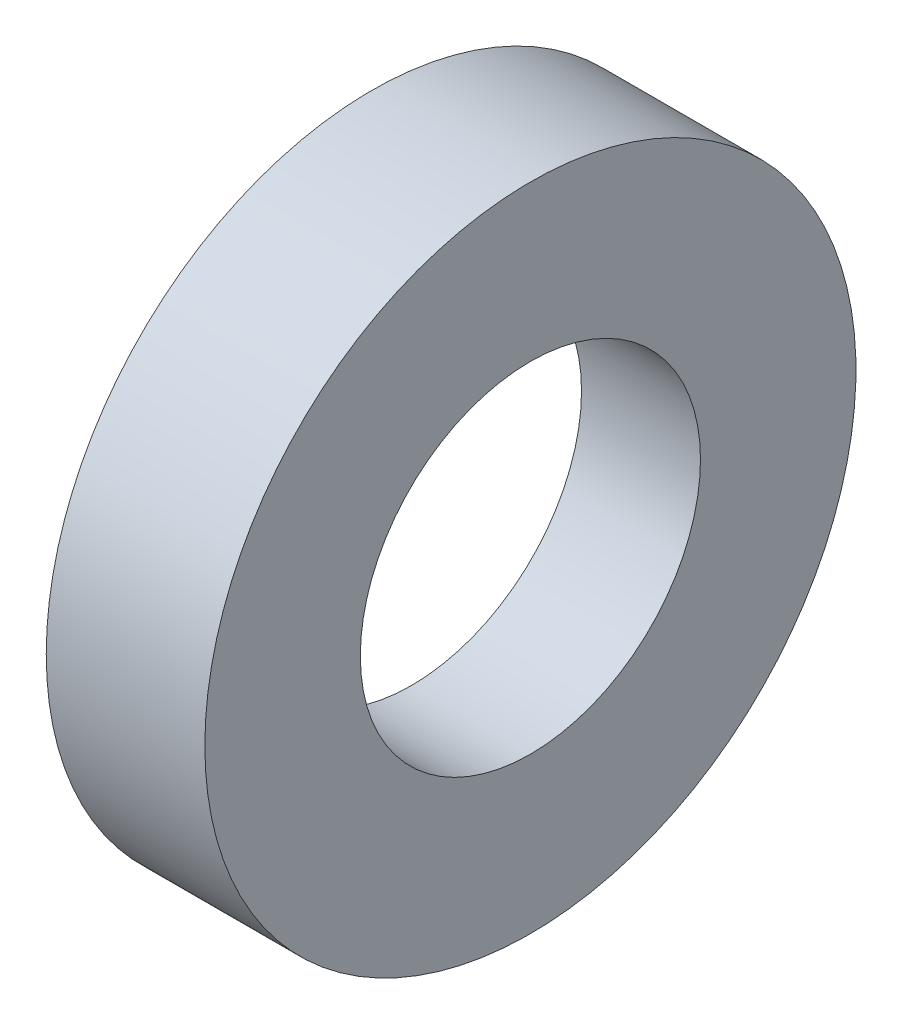
from build123d import *


with BuildPart() as part:
    # Sketch1 → Revolve1 (revolve)
    with BuildSketch(Plane.XY):
        Polygon((4.581632653, 1.63), (5.721632653, 1.63), (5.721632653, 3.12), (4.201632653, 3.12), (4.201632653, 2.23), (4.581632653, 2.23), align=None)
    revolve(axis=Axis((0, 0, 0), (1, 0, 0)))


solid = part.part
